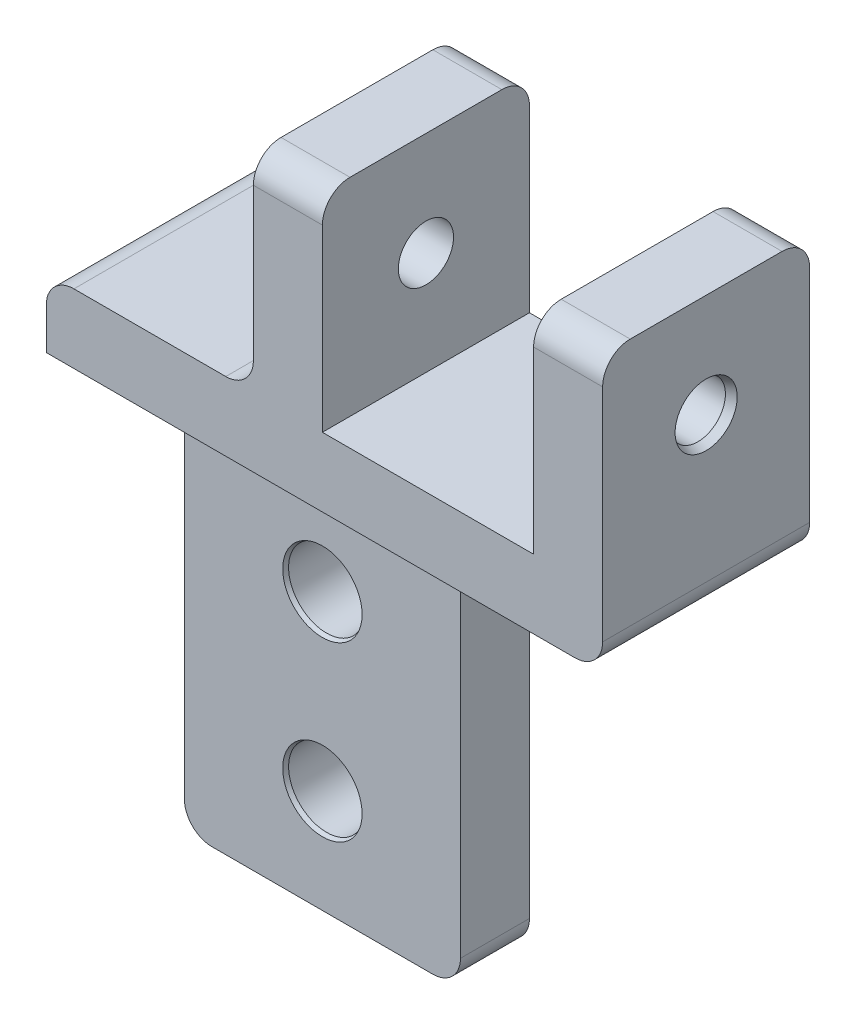
from build123d import *

# Parameters (mm, degrees)
BOSS_EXTRUDE1_DEPTH                 = 20
BOSS_EXTRUDE2_DEPTH                 = 20.3
SKETCH4_W                           = 5
SKETCH4_H                           = 15
BOSS_EXTRUDE3_DEPTH                 = 15
CHAMFER2_SIZE                       = 7.5
FILLET1_R                           = 7.5
F_5_5_5_5_DIAMETER_HOLE1_AT_2_COUNT = 2
F_5_5_5_5_DIAMETER_HOLE1_AT_2_PITCH = 12.50000000000005
FILLET2_R                           = 2


with BuildPart() as part:
    # Sketch1 → Boss-Extrude1 (new body)
    with BuildSketch(Plane(origin=(0, 0, 0), x_dir=(0, 0, -1), z_dir=(1, 0, 0))):
        Polygon((-4.59e-15, 15), (-6.12e-15, 20), (-10.000000000000007, 20), (-10.000000000000004, 15), align=None)
        Polygon((4.999999999999994, -20), (6.12e-15, -20), (-6.12e-15, 20), (4.999999999999994, 20), align=None)
    extrude(amount=BOSS_EXTRUDE1_DEPTH)

    # Sketch3 → Boss-Extrude2 (add)
    with BuildSketch(Plane(origin=(20, 0, 0), x_dir=(0, 0, -1), z_dir=(1, 0, 0))):
        Polygon((-10.000000000000007, 20), (-10.000000000000004, 15), (4.999999999999994, 15), (4.999999999999994, 20), align=None)
    extrude(amount=BOSS_EXTRUDE2_DEPTH)

    # Sketch4 → Boss-Extrude3 (add)
    with BuildSketch(Plane(origin=(0, 20, 0), x_dir=(1, 0, 0), z_dir=(0, 1, 0))):
        Polygon((20.00000000000001, -10.000000000000007), (20.000000000000004, 4.999999999999994), (15.000000000000007, 4.999999999999994), (15.000000000000007, -10.000000000000007), align=None)
        with Locations((37.800000000000004, -2.5000000000000067)):
            Rectangle(SKETCH4_W, SKETCH4_H)
    extrude(amount=BOSS_EXTRUDE3_DEPTH)

    # Chamfer2
    chamfer2_edges = [part.edges().sort_by_distance(p)[0] for p in [
        (10, 15, 4.96e-15),
    ]]
    chamfer(chamfer2_edges, length=CHAMFER2_SIZE)

    # Fillet1
    # the kernel refuses this fillet: 7.5 mm, written as the material it adds along each edge
    with BuildSketch(Plane(origin=(0, 15, 7.500000000000005), x_dir=(0, -0.7071067811865472, -0.7071067811865479), z_dir=(1, 0, 0))) as fillet1_piece_1:
        with BuildLine():
            CenterArc((3.068709480812204, -7.500000000000002), FILLET1_R, 90, 40.15544377727605)
            Line((-1.7677669529663684, -1.7677669529663669), (0, 0))
            Line((0, 0), (3.0687094808122044, -1.2e-16))
        make_face()
    extrude(amount=20)
    with BuildSketch(Plane(origin=(20, 15, 26.250000000000007), x_dir=(0, -1, 0), z_dir=(0, 0, -1))) as fillet1_piece_2_section:
        with BuildLine():
            CenterArc((FILLET1_R, -FILLET1_R), FILLET1_R, 90, 90)
            Line((0, -FILLET1_R), (0, 0))
            Line((0, 0), (FILLET1_R, 0))
        make_face()
    fillet1_piece_2 = extrude(amount=31.25, mode=Mode.PRIVATE)
    fillet1_piece_2 = split(fillet1_piece_2, bisect_by=Plane(origin=(20, 24.375, 16.875000000000014), z_dir=(0, 0.7071067811865477, -0.7071067811865474)), keep=Keep.TOP, mode=Mode.PRIVATE)
    add(fillet1_piece_2)
    with BuildSketch(Plane(origin=(20, 15, 26.250000000000007), x_dir=(0, -1, 0), z_dir=(0, 0, -1))) as fillet1_piece_3a_section:
        with BuildLine():
            CenterArc((FILLET1_R, -FILLET1_R), FILLET1_R, 90, 90)
            Line((0, -FILLET1_R), (0, 0))
            Line((0, 0), (FILLET1_R, 0))
        make_face()
    fillet1_piece_3a = extrude(amount=31.25, mode=Mode.PRIVATE)
    fillet1_piece_3a = split(fillet1_piece_3a, bisect_by=Plane(origin=(20, 15.000000000000012, 10), z_dir=(0, 7.1e-16, -1)), keep=Keep.TOP, mode=Mode.PRIVATE)
    fillet1_piece_3a = split(fillet1_piece_3a, bisect_by=Plane(origin=(20, 24.375, 16.87500000000001), z_dir=(0, -0.7071067811865477, 0.7071067811865474)), keep=Keep.TOP, mode=Mode.PRIVATE)
    with BuildSketch(Plane(origin=(0, 15, 7.500000000000005), x_dir=(0, -0.7071067811865472, -0.7071067811865479), z_dir=(1, 0, 0))) as fillet1_piece_3b_section:
        with BuildLine():
            CenterArc((3.068709480812204, -7.500000000000002), FILLET1_R, 90, 40.15544377727605)
            Line((-1.7677669529663684, -1.7677669529663669), (0, 0))
            Line((0, 0), (3.0687094808122044, -1.2e-16))
        make_face()
    fillet1_piece_3b = extrude(amount=27.67177370203051, mode=Mode.PRIVATE)
    fillet1_piece_3b = split(fillet1_piece_3b, bisect_by=Plane(origin=(20, 15, 7.500000000000005), z_dir=(1, 0, 0)), keep=Keep.TOP, mode=Mode.PRIVATE)
    fillet1_piece_3 = fillet1_piece_3a & fillet1_piece_3b
    add(fillet1_piece_3)

    # Sketch7 → Ø4.0 (4) Diameter Hole1 (revolve, cut)
    with BuildSketch(Plane(origin=(15.000000000000007, 27.500000000000004, 2.5000000000000075), x_dir=(0, 0, 1), z_dir=(0, 1, 0))):
        Polygon((0, 0), (-1.22e-15, 5.000000000000001), (1.9999999999999967, 5.000000000000001), (1.9999999999999996, 0.6035533905932753), (2.2500000000000004, -1.73e-15), align=None)
    f_4_0_4_diameter_hole1 = revolve(axis=Axis((8.650000000000016, 27.500000000000004, 2.5000000000000075), (1, 0, 0)), mode=Mode.SUBTRACT)

    # Mirror1: Ø4.0 (4) Diameter Hole1 across plane
    add(f_4_0_4_diameter_hole1.mirror(Plane(origin=(27.65000000000001, 0, -6.4e-15), x_dir=(2.3e-16, 0, 1), z_dir=(1, 0, -2.3e-16))), mode=Mode.SUBTRACT)

    # Sketch9 → Ø5.5 (5.5) Diameter Hole1 (revolve, cut)
    with BuildSketch(Plane(origin=(10, 0, 0), x_dir=(0, -1, 0), z_dir=(1, 0, 0))):
        Polygon((0, 0), (-1.22e-15, 4.999999999999994), (2.749999999999999, 4.999999999999994), (2.7499999999999996, 0.30177669529663986), (2.875, 0), align=None)
    f_5_5_5_5_diameter_hole1 = revolve(axis=Axis((10, 0, 6.349999999999991), (0, 0, -1)), mode=Mode.SUBTRACT)

    # Ø5.5 (5.5) Diameter Hole1 at 2: Ø5.5 (5.5) Diameter Hole1 ×2
    with Locations(*[(0, -i * F_5_5_5_5_DIAMETER_HOLE1_AT_2_PITCH, 0) for i in range(1, F_5_5_5_5_DIAMETER_HOLE1_AT_2_COUNT)]):
        add(f_5_5_5_5_diameter_hole1, mode=Mode.SUBTRACT)

    # Fillet2
    fillet2_edges = [part.edges().sort_by_distance(p)[0] for p in [
        (0, -20, -2.5),
        (20, -20, -2.5),
        (40.3, 15, 2.5000000000000053),
        (17.500000000000007, 35, 10.000000000000007),
        (17.500000000000007, 35, -4.999999999999994),
        (15.000000000000007, 20, 2.500000000000007),
        (37.800000000000004, 35, -4.999999999999994),
        (37.800000000000004, 35, 10.000000000000007),
        (0, 20, 2.500000000000006),
    ]]
    fillet(fillet2_edges, radius=FILLET2_R)


solid = part.part
